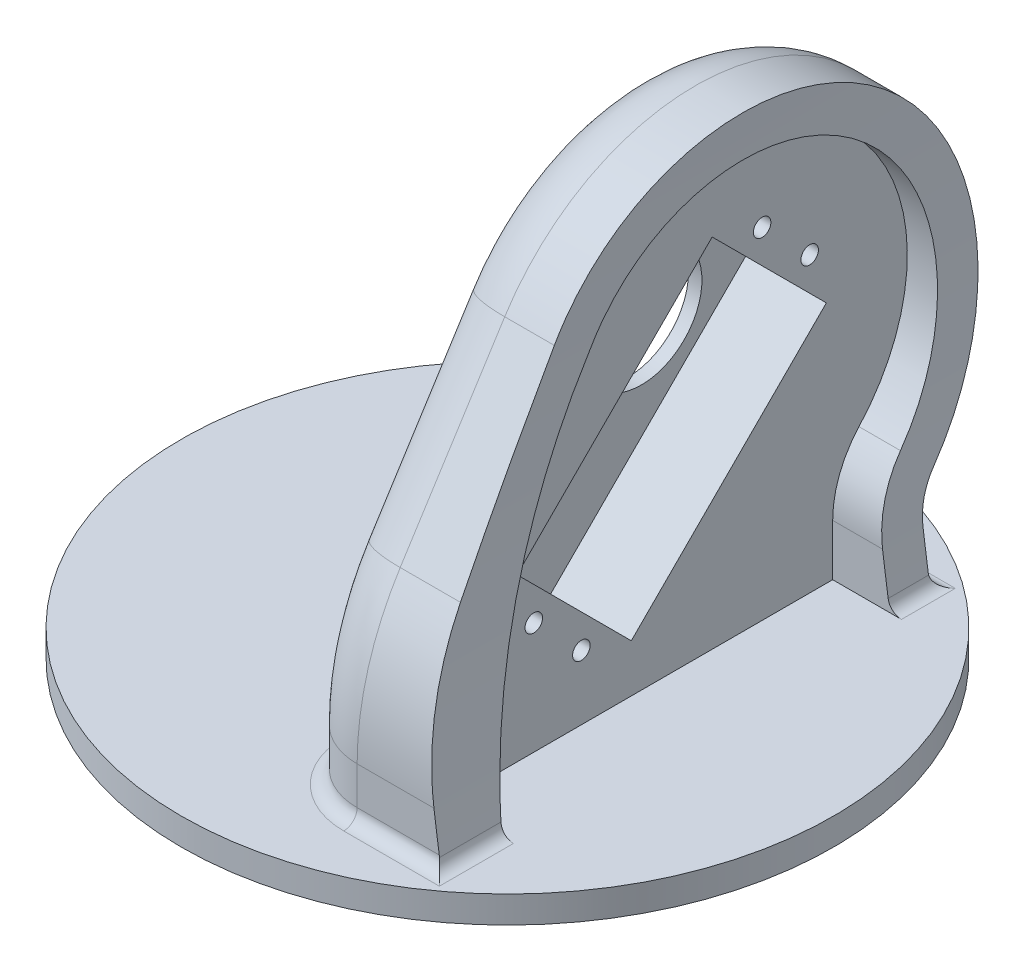
from build123d import *

# Parameters (mm, degrees)
SKETCH1_R                       = 48.5
SKETCH1_R_2                     = 1.5
BOSS_EXTRUDE1_DEPTH             = 4
SKETCH6_R                       = 3.75
CUT_EXTRUDE15_DEPTH             = 1.5
BOSS_EXTRUDE3_START             = 4
SKETCH5_R                       = 9
BOSS_EXTRUDE3_DEPTH             = 14
CUT_EXTRUDE16_START             = 6
SKETCH9_R                       = 1.3
CUT_EXTRUDE16_DEPTH             = 91.444646155
BOSS_EXTRUDE4_DEPTH             = 9
BOSS_EXTRUDE4_DIRECTION_2_REACH = 108.638
CUT_EXTRUDE17_DEPTH             = 101.75311462
CUT_EXTRUDE17_DEPTH_BACK        = 101.75311462
FILLET2_R                       = 10
FILLET3_R                       = 2


with BuildPart() as part:
    # Sketch1 → Boss-Extrude1 (new body)
    with BuildSketch(Plane(origin=(0, 0, 0), x_dir=(1, 0, 0), z_dir=(0, 1, 0))):
        with Locations(Location((0, 0, 0), (0, 0, 270))):
            Circle(SKETCH1_R)
        with Locations(Location((0, 7.25, 0), (0, 0, 270))):
            Circle(SKETCH1_R_2, mode=Mode.SUBTRACT)
        with Locations(Location((0, -7.25, 0), (0, 0, 270))):
            Circle(SKETCH1_R_2, mode=Mode.SUBTRACT)
    extrude(amount=BOSS_EXTRUDE1_DEPTH)

    # Sketch6 → Cut-Extrude15 (cut)
    with BuildSketch(Plane.XZ):
        with Locations(Location((0, 0, 0), (0, 0, 270))):
            Circle(SKETCH6_R)
    extrude(amount=-CUT_EXTRUDE15_DEPTH, mode=Mode.SUBTRACT)

    # Sketch5 → Boss-Extrude3 (add)
    with BuildSketch(Plane(origin=(0, 0, 0), x_dir=(0, 0, -1), z_dir=(1, 0, 0)).offset(BOSS_EXTRUDE3_START)):
        with BuildLine():
            Line((-30.34, 4), (30.34, 4))
            Line((30.34, 4), (30.34, 11.64))
            ThreePointArc((30.34, 11.64), (31.352340729, 17.057138369), (34.252718415, 21.743078098))
            ThreePointArc((34.252718415, 21.743078098), (30.606439261, 62.158587297), (-9.338476496, 55.009290775))
            Line((-9.338476496, 55.009290775), (-24.869934587, 30.494686245))
            ThreePointArc((-24.869934587, 30.494686245), (-28.94485921, 21.456068574), (-30.34, 11.64))
            Line((-30.34, 11.64), (-30.34, 4))
        make_face()
        with Locations((13.91, 40.28)):
            Circle(SKETCH5_R, mode=Mode.SUBTRACT)
    extrude(amount=BOSS_EXTRUDE3_DEPTH)

    # Sketch9 → Cut-Extrude16 (cut, through all)
    with BuildSketch(Plane(origin=(0, 0, 0), x_dir=(0, 0, -1), z_dir=(1, 0, 0)).offset(CUT_EXTRUDE16_START)):
        with Locations(Location((26.926504294, 47.525999231, 0), (0, 0, 180))):
            Circle(SKETCH9_R)
        with Locations(Location((19.855436483, 54.597067043, 0), (0, 0, 180))):
            Circle(SKETCH9_R)
        with Locations(Location((-7.014621202, 13.584873734, 0), (0, 0, 180))):
            Circle(SKETCH9_R)
        with Locations(Location((-14.085689014, 20.655941546, 0), (0, 0, 180))):
            Circle(SKETCH9_R)
        Polygon((0.41, 11.11), (29.401378029, 40.101378029), (12.43081528, 57.071940777), (-16.560562748, 28.080562748), align=None)
    extrude(amount=CUT_EXTRUDE16_DEPTH, mode=Mode.SUBTRACT)

    # Sketch10 → Boss-Extrude4 (add)
    with BuildSketch(Plane(origin=(18, 0, 0), x_dir=(0, 0, -1), z_dir=(1, 0, 0))):
        with BuildLine():
            Line((36.34, 4), (36.34, 11.64))
            ThreePointArc((36.34, 11.64), (36.947404437, 14.890283021), (38.687631049, 17.701846859))
            ThreePointArc((38.687631049, 17.701846859), (34.246427187, 66.928334449), (-14.406872962, 58.22042099))
            Line((-14.406872962, 58.22042099), (-29.938331054, 33.705816459))
            ThreePointArc((-29.938331054, 33.705816459), (-34.707253625, 23.127837278), (-36.34, 11.64))
            Line((-36.34, 11.64), (-36.34, 4))
            Line((-36.34, 4), (-27.34, 4))
            ThreePointArc((-27.34, 4), (-21.853757974, 30.744943155), (-9.338476496, 55.009290775))
            ThreePointArc((-9.338476496, 55.009290775), (30.606439261, 62.158587297), (34.252718415, 21.743078098))
            ThreePointArc((34.252718415, 21.743078098), (31.352340729, 17.057138369), (30.34, 11.64))
            Line((30.34, 11.64), (30.34, 4))
            Line((30.34, 4), (36.34, 4))
        make_face()
    extrude(amount=BOSS_EXTRUDE4_DEPTH)

    # Boss-Extrude4 direction 2: up to this face of the body (flat: up to its plane)
    boss_extrude4_direction_2_end = Plane(part.part.faces().sort_by_distance((4, 32.000082857, -6.789790598))[0])
    # Sketch10 → Boss-Extrude4 direction 2 (add, up to the picked face)
    with BuildSketch(Plane(origin=(18, 0, 0), x_dir=(0, 0, -1), z_dir=(1, 0, 0)), mode=Mode.PRIVATE) as boss_extrude4_direction_2_sk1:
        with BuildLine():
            Line((36.34, 4), (36.34, 11.64))
            ThreePointArc((36.34, 11.64), (36.947404437, 14.890283021), (38.687631049, 17.701846859))
            ThreePointArc((38.687631049, 17.701846859), (34.246427187, 66.928334449), (-14.406872962, 58.22042099))
            Line((-14.406872962, 58.22042099), (-29.938331054, 33.705816459))
            ThreePointArc((-29.938331054, 33.705816459), (-34.707253625, 23.127837278), (-36.34, 11.64))
            Line((-36.34, 11.64), (-36.34, 4))
            Line((-36.34, 4), (-27.34, 4))
            ThreePointArc((-27.34, 4), (-21.853757974, 30.744943155), (-9.338476496, 55.009290775))
            ThreePointArc((-9.338476496, 55.009290775), (30.606439261, 62.158587297), (34.252718415, 21.743078098))
            ThreePointArc((34.252718415, 21.743078098), (31.352340729, 17.057138369), (30.34, 11.64))
            Line((30.34, 11.64), (30.34, 4))
            Line((30.34, 4), (36.34, 4))
        make_face()
    boss_extrude4_direction_2_tool1 = split(extrude(boss_extrude4_direction_2_sk1.sketch, amount=-BOSS_EXTRUDE4_DIRECTION_2_REACH, mode=Mode.PRIVATE), bisect_by=boss_extrude4_direction_2_end, keep=Keep.BOTH, mode=Mode.PRIVATE)
    add(boss_extrude4_direction_2_tool1.solids().sort_by(Axis((18, 63.025419, -31.267953), (-1, 0, 0)))[0])

    # Sketch11 → Cut-Extrude17 (cut, two sides: drawn at the far end of the back side and taken through both)
    with BuildSketch(Plane.XY.offset(-CUT_EXTRUDE17_DEPTH_BACK)):
        with BuildLine():
            Line((27, 73.801694463), (21, 73.801694463))
            ThreePointArc((21, 73.801694463), (22.52665425, 38.804454133), (26.5, 4))
            Line((26.5, 4), (27, 4))
            Line((27, 4), (27, 73.801694463))
        make_face()
    extrude(amount=CUT_EXTRUDE17_DEPTH + CUT_EXTRUDE17_DEPTH_BACK, mode=Mode.SUBTRACT)

    # Fillet2
    # the kernel refuses this fillet: 10 mm, written as the material it takes off along each edge
    with BuildSketch(Plane(origin=(4, 40.28, -13.91), x_dir=(0, -0.6735385398377843, -0.7391521056948872), z_dir=(0, -0.7391521056948872, 0.6735385398377843))) as fillet2_piece_1:
        with BuildLine():
            CenterArc((33.521694463 - FILLET2_R, FILLET2_R), FILLET2_R, 270, 90)
            Line((33.521694463, FILLET2_R), (33.521694463, 0))
            Line((33.521694463, 0), (33.521694463 - FILLET2_R, 0))
        make_face()
    revolve(axis=Axis((4, 40.28, -13.91), (1, 0, 0)), revolution_arc=189.984074965, mode=Mode.SUBTRACT)
    with BuildSketch(Plane(origin=(4, 58.22042099, 14.406872962), x_dir=(0, -0.5351883691335427, -0.8447327444489049), z_dir=(0, -0.8447327444489049, 0.5351883691335426))) as fillet2_piece_2:
        with BuildLine():
            CenterArc((FILLET2_R, FILLET2_R), FILLET2_R, 180, 90)
            Line((0, FILLET2_R), (0, 0))
            Line((0, 0), (FILLET2_R, 0))
        make_face()
    extrude(amount=29.020544891, mode=Mode.SUBTRACT)
    with BuildSketch(Plane(origin=(4, 11.64, -4.89), x_dir=(0, 0.5351883691335412, 0.8447327444489058), z_dir=(0, 0.8447327444489058, -0.5351883691335412))) as fillet2_piece_3:
        with BuildLine():
            CenterArc((41.23 - FILLET2_R, FILLET2_R), FILLET2_R, 270, 90)
            Line((41.23, FILLET2_R), (41.23, 0))
            Line((41.23, 0), (41.23 - FILLET2_R, 0))
        make_face()
    revolve(axis=Axis((4, 11.64, -4.89), (1, 0, 0)), revolution_arc=32.356687045, mode=Mode.SUBTRACT)
    with BuildSketch(Plane(origin=(4, 11.64, 36.34), x_dir=(0, 0, -1), z_dir=(0, -1, 0)), Plane(origin=(4, 4, -36.34), x_dir=(0, 0, 1), z_dir=(0, 1, 0))) as fillet2_piece_4:
        with BuildLine():
            CenterArc((FILLET2_R, FILLET2_R), FILLET2_R, 180, 90)
            Line((0, FILLET2_R), (0, 0))
            Line((0, 0), (FILLET2_R, 0))
        make_face()
    extrude(amount=7.64, mode=Mode.SUBTRACT)
    with BuildSketch(Plane(origin=(4, 11.64, -45.34), x_dir=(0, 0.6735385398377856, 0.739152105694886), z_dir=(0, 0.739152105694886, -0.6735385398377856))) as fillet2_piece_5:
        with BuildLine():
            CenterArc((9 + FILLET2_R, FILLET2_R), FILLET2_R, 180, 90)
            Line((9, FILLET2_R), (9, 0))
            Line((9, 0), (9 + FILLET2_R, 0))
        make_face()
    revolve(axis=Axis((4, 11.64, -45.34), (1, 0, 0)), revolution_arc=42.340762009, mode=Mode.SUBTRACT)

    # Fillet3
    fillet3_edges = [part.edges().sort_by_distance(p)[0] for p in [
        (20.25, 4, -36.34),
        (20.25, 4, 36.34),
        (6.928932188, 4, 33.411067812),
        (4, 4, 0),
        (6.928932188, 4, -33.411067812),
    ]]
    fillet(fillet3_edges, radius=FILLET3_R)
    fillet3_2_edges = [part.edges().sort_by_distance(p)[0] for p in [
        (26.5, 4, -33.34),
    ]]
    fillet(fillet3_2_edges, radius=FILLET3_R)
    fillet3_3_edges = [part.edges().sort_by_distance(p)[0] for p in [
        (26.5, 4, 31.84),
    ]]
    fillet(fillet3_3_edges, radius=FILLET3_R)


solid = part.part
